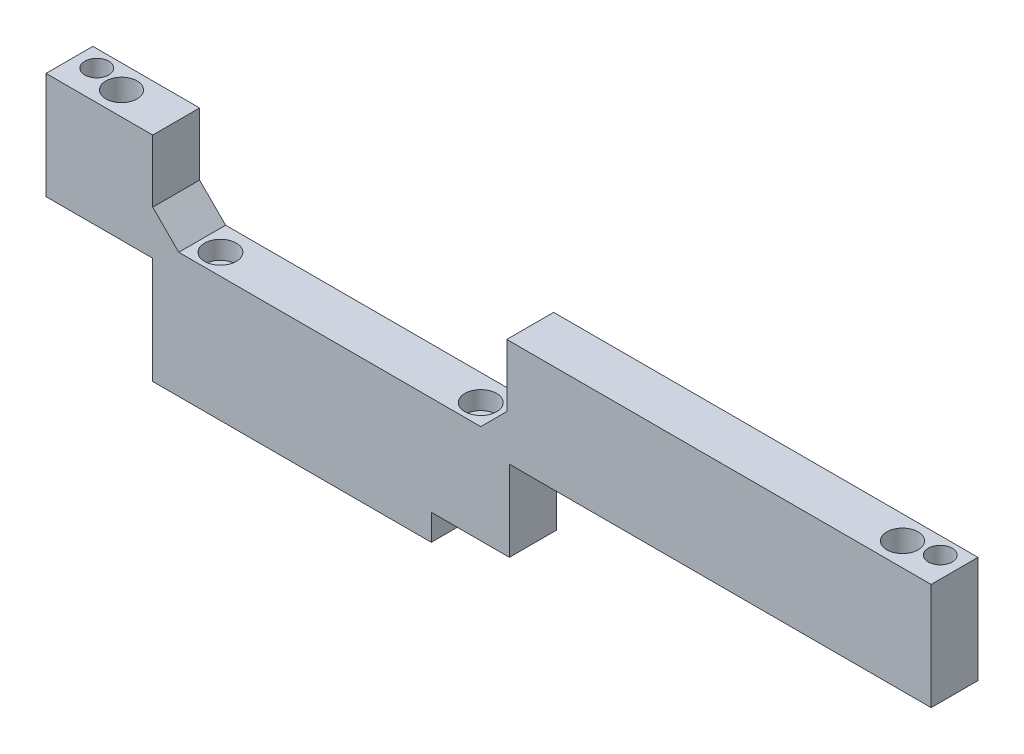
from build123d import *

# Parameters (mm, degrees)
BOSS_EXTRUDE1_DEPTH = 9
SKETCH7_R           = 1.75
CUT_EXTRUDE5_DEPTH  = 95.799789029
SKETCH8_R           = 3
CUT_EXTRUDE6_DEPTH  = 10
SKETCH9_W           = 68
SKETCH9_H           = 9
CUT_EXTRUDE7_DEPTH  = 17
CHAMFER1_SIZE       = 5
SKETCH10_R          = 3.05
CUT_EXTRUDE8_DEPTH  = 3.5
SKETCH11_R          = 2.3
CUT_EXTRUDE9_DEPTH  = 10
SKETCH12_R          = 8
SKETCH12_R_2        = 7.5
CUT_EXTRUDE13_DEPTH = 5


with BuildPart() as part:
    # Sketch1 → Boss-Extrude1 (new body)
    with BuildSketch(Plane.XY):
        Polygon((-85, 18.585209003), (85, 18.585209003), (85, -1.914790997), (4, -1.914790997), (4, -17.414790997), (-11, -17.414790997), (-11, -22.414790997), (-64.5, -22.414790997), (-64.5, -1.914790997), (-85, -1.914790997), align=None)
    extrude(amount=BOSS_EXTRUDE1_DEPTH)

    # Sketch7 → Cut-Extrude5 (cut, through all)
    with BuildSketch(Plane(origin=(0, 18.585209003, 0), x_dir=(1, 0, 0), z_dir=(0, 1, 0))):
        with Locations((-75, -4.5)):
            Circle(SKETCH7_R)
        with Locations((75, -4.5)):
            Circle(SKETCH7_R)
    extrude(amount=-CUT_EXTRUDE5_DEPTH, mode=Mode.SUBTRACT)

    # Sketch8 → Cut-Extrude6 (cut)
    with BuildSketch(Plane(origin=(0, 18.585209003, 0), x_dir=(1, 0, 0), z_dir=(0, 1, 0))):
        with Locations((-75, -4.5)):
            Circle(SKETCH8_R)
        with Locations((75, -4.5)):
            Circle(SKETCH8_R)
    extrude(amount=-CUT_EXTRUDE6_DEPTH, mode=Mode.SUBTRACT)

    # Sketch9 → Cut-Extrude7 (cut)
    with BuildSketch(Plane(origin=(0, 18.585209003, 0), x_dir=(1, 0, 0), z_dir=(0, 1, 0))):
        with Locations((-30.5, -4.5)):
            Rectangle(SKETCH9_W, SKETCH9_H)
    extrude(amount=-CUT_EXTRUDE7_DEPTH, mode=Mode.SUBTRACT)

    # Chamfer1
    chamfer1_edges = [part.edges().sort_by_distance(p)[0] for p in [
        (3.5, 1.585209003, 4.5),
        (-64.5, 1.585209003, 4.5),
    ]]
    chamfer(chamfer1_edges, length=CHAMFER1_SIZE)

    # Sketch10 → Cut-Extrude8 (cut)
    with BuildSketch(Plane(origin=(0, 1.585209003, 0), x_dir=(1, 0, 0), z_dir=(0, 1, 0))):
        with Locations((-55.5, -5)):
            Circle(SKETCH10_R)
        with Locations((-5.5, -5)):
            Circle(SKETCH10_R)
    extrude(amount=-CUT_EXTRUDE8_DEPTH, mode=Mode.SUBTRACT)

    # Sketch11 → Cut-Extrude9 (cut)
    with BuildSketch(Plane(origin=(0, 18.585209003, 0), x_dir=(1, 0, 0), z_dir=(0, 1, 0))):
        with Locations((-81, -3.25)):
            Circle(SKETCH11_R)
        with Locations((81, -3.25)):
            Circle(SKETCH11_R)
    extrude(amount=-CUT_EXTRUDE9_DEPTH, mode=Mode.SUBTRACT)

    # Sketch12 → Cut-Extrude13 (cut)
    with BuildSketch(Plane.XZ.offset(1.914790997)):
        with Locations((-75, -6.5)):
            Circle(SKETCH12_R)
        with Locations((75, -6)):
            Circle(SKETCH12_R_2)
    extrude(amount=-CUT_EXTRUDE13_DEPTH, mode=Mode.SUBTRACT)


solid = part.part
